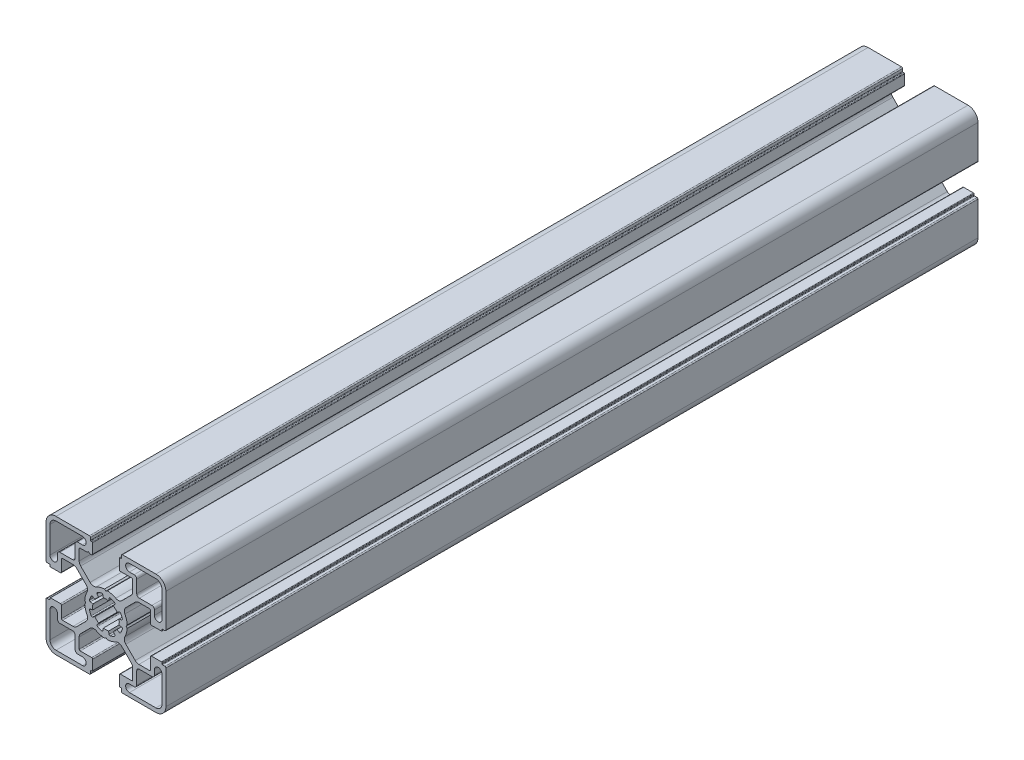
from build123d import *

# Parameters (mm, degrees)
BOSS_EXTRUDE1_DEPTH      = 152.4
FILLET4_R                = 1.95
FILLET5_R                = 0.39
DELETEFACE1_START        = -152.4
DELETEFACE1_DEPTH        = 304.8
CUT_EXTRUDE1_DEPTH       = 156.686415592
CIRPATTERN2_COUNT        = 3
CIRPATTERN2_ANGLE        = 180
FILLET2_R                = 0.39
FILLET3_R                = 0.195
CUT_EXTRUDE2_DEPTH       = 307.456424309
CUT_EXTRUDE2_DEPTH_BACK  = 307.456424309
SKETCH5_R                = 6.375
BOSS_EXTRUDE2_DEPTH      = 152.4
FILLET6_R                = 0.39
CIRPATTERN1_COUNT        = 8
FILLET6_OF_CIRPATTERN1_R = 0.39
CUT_EXTRUDE3_DEPTH       = 156.686415592
CUT_EXTRUDE3_DEPTH_BACK  = 156.686415592


# Read off the part's stored shape, not the designer's step: DeleteFace1
with BuildPart() as part:
    # Sketch3 → Boss-Extrude1 (new, symmetric)
    with BuildSketch(Plane.XY):
        with BuildLine():
            Line((0, -8), (0, -5))
            ThreePointArc((0, -5), (3.535533906, -3.535533906), (5, 0))
            Line((5, 0), (8, 0))
            ThreePointArc((8, 0), (7.578104083, -2.563657252), (6.356915373, -4.856915373))
            Line((6.356915373, -4.856915373), (11.55, -10.05))
            Line((11.55, -10.05), (16.7, -10.05))
            Line((16.7, -10.05), (16.7, -5))
            Line((16.7, -5), (21, -5))
            Line((21, -5), (21, 0))
            Line((21, 0), (22.5, 0))
            Line((22.5, 0), (22.5, -18.75))
            ThreePointArc((22.5, -18.75), (21.401650429, -21.401650429), (18.75, -22.5))
            Line((18.75, -22.5), (0, -22.5))
            Line((0, -22.5), (0, -21))
            Line((0, -21), (5, -21))
            Line((5, -21), (5, -16.7))
            Line((5, -16.7), (10.05, -16.7))
            Line((10.05, -16.7), (10.05, -11.55))
            Line((10.05, -11.55), (4.856915373, -6.356915373))
            ThreePointArc((4.856915373, -6.356915373), (2.563657252, -7.578104083), (0, -8))
        make_face()
        with BuildLine():
            Line((18.2, -8.79375), (18.2, -10.575))
            ThreePointArc((18.2, -10.575), (17.914429112, -11.264429112), (17.225, -11.55))
            Line((17.225, -11.55), (12.525, -11.55))
            ThreePointArc((12.525, -11.55), (11.835570888, -11.835570888), (11.55, -12.525))
            Line((11.55, -12.525), (11.55, -17.225))
            ThreePointArc((11.55, -17.225), (11.264429112, -17.914429112), (10.575, -18.2))
            Line((10.575, -18.2), (8.79375, -18.2))
            ThreePointArc((8.79375, -18.2), (7.39375, -19.6), (8.79375, -21))
            Line((8.79375, -21), (18.75, -21))
            ThreePointArc((18.75, -21), (20.340990258, -20.340990258), (21, -18.75))
            Line((21, -18.75), (21, -8.79375))
            ThreePointArc((21, -8.79375), (19.6, -7.39375), (18.2, -8.79375))
        make_face(mode=Mode.SUBTRACT)
    extrude(amount=BOSS_EXTRUDE1_DEPTH, both=True)

    # Fillet4
    fillet4_edges = [part.edges().sort_by_distance(p)[0] for p in [
        (10.05, -11.55, 0),
        (4.856915373, -6.356915373, 0),
        (6.356915373, -4.856915373, 0),
        (11.55, -10.05, 0),
    ]]
    fillet(fillet4_edges, radius=FILLET4_R)

    # Fillet5
    fillet5_edges = [part.edges().sort_by_distance(p)[0] for p in [
        (5, -21, 0),
        (5, -16.7, 0),
        (10.05, -16.7, 0),
        (16.7, -10.05, 0),
        (16.7, -5, 0),
        (21, -5, 0),
    ]]
    fillet(fillet5_edges, radius=FILLET5_R)

    # Mirror1: part across plane


with BuildPart() as part_1:
    add(part.part)
    add(part.part.mirror(Plane.ZX))

    # DeleteFace1 outline → DeleteFace1 (cut)
    with BuildSketch(Plane.XY.offset(DELETEFACE1_START)):
        with BuildLine():
            ThreePointArc((4.61, 21), (4.885771645, 20.885771645), (5, 20.61))
            Line((5, 20.61), (5, 21))
            Line((5, 21), (4.61, 21))
        make_face()
    extrude(amount=DELETEFACE1_DEPTH, mode=Mode.SUBTRACT)

    # Sketch4 → Cut-Extrude1 (cut, symmetric)
    with BuildSketch(Plane.XY):
        Polygon((5.8, 21), (5.8, 22.5), (0, 22.5), (-5.8, 22.5), (-5.8, 21), (-5, 21), (-5, 16.7), (5, 16.7), (5, 21), align=None)
    cut_extrude1 = extrude(amount=CUT_EXTRUDE1_DEPTH, both=True, mode=Mode.SUBTRACT)

    # CirPattern2: Cut-Extrude1 ×3 about axis
    cirpattern2_axis = Axis((0, 0, 107.4), (0, 0, -1))
    for i in range(1, CIRPATTERN2_COUNT):
        add(cut_extrude1.rotate(cirpattern2_axis, i * CIRPATTERN2_ANGLE / (CIRPATTERN2_COUNT - 1)), mode=Mode.SUBTRACT)

    # Fillet2
    fillet2_edges = [part_1.edges().sort_by_distance(p)[0] for p in [
        (5.8, 22.5, 0),
        (22.5, 5.8, 0),
        (22.5, -5.8, 0),
        (5.8, -22.5, 0),
    ]]
    fillet(fillet2_edges, radius=FILLET2_R)

    # Fillet3
    fillet3_edges = [part_1.edges().sort_by_distance(p)[0] for p in [
        (5, 21, 0),
        (5.8, 21, 0),
        (21, -5, 0),
        (21, -5.8, 0),
        (21, 5, 0),
        (21, 5.8, 0),
        (5, -21, 0),
        (5.8, -21, 0),
    ]]
    fillet(fillet3_edges, radius=FILLET3_R)

    # Mirror2: part across plane


with BuildPart() as part_2:
    add(part_1.part)
    add(part_1.part.mirror(Plane(origin=(0, 0, 0), x_dir=(0, 0, 1), z_dir=(1, 0, 0))))

    # Sketch5 → Cut-Extrude2 (cut, two sides: drawn at the far end of the back side and taken through both)
    with BuildSketch(Plane.XY.offset(152.4).offset(-CUT_EXTRUDE2_DEPTH_BACK)):
        Circle(SKETCH5_R)
        Polygon((-0.580185128, 8), (0.580185128, 8), (0, 7.59375), align=None)
        Polygon((-8, 0.580185128), (-8, -0.580185128), (-7.59375, 0), align=None)
        Polygon((8, 0.580185128), (8, -0.580185128), (7.59375, 0), align=None)
        Polygon((-0.580185128, -8), (0.580185128, -8), (0, -7.59375), align=None)
    extrude(amount=CUT_EXTRUDE2_DEPTH + CUT_EXTRUDE2_DEPTH_BACK, mode=Mode.SUBTRACT)

    # Sketch6 → Boss-Extrude2 (add, symmetric)
    with BuildSketch(Plane.XY):
        with BuildLine():
            Line((-0.97545161, -4.903926402), (-1.243700803, -6.252506163))
            ThreePointArc((-1.243700803, -6.252506163), (0, -6.375), (1.243700803, -6.252506163))
            Line((1.243700803, -6.252506163), (0.97545161, -4.903926402))
            ThreePointArc((0.97545161, -4.903926402), (0, -5), (-0.97545161, -4.903926402))
        make_face()
    boss_extrude2 = extrude(amount=BOSS_EXTRUDE2_DEPTH, both=True)

    # Fillet6
    fillet6_edges = [part_2.edges().sort_by_distance(p)[0] for p in [
        (-1.243700803, -6.252506163, 0),
        (1.243700803, -6.252506163, 0),
    ]]
    fillet(fillet6_edges, radius=FILLET6_R)

    # CirPattern1: Boss-Extrude2 ×8 about axis
    cirpattern1_axis = Axis((0, 0, 0), (0, 0, 1))
    for i in range(1, CIRPATTERN1_COUNT):
        add(boss_extrude2.rotate(cirpattern1_axis, i * 360 / CIRPATTERN1_COUNT))

    # Fillet6 of CirPattern1
    fillet6_of_cirpattern1_edges = [part_2.edges().sort_by_distance(p)[0] for p in [
        (3.541760235, -5.300618778, 0),
        (5.300618778, -3.541760235, 0),
        (6.252506163, -1.243700803, 0),
        (6.252506163, 1.243700803, 0),
        (5.300618778, 3.541760235, 0),
        (3.541760235, 5.300618778, 0),
        (1.243700803, 6.252506163, 0),
        (-1.243700803, 6.252506163, 0),
        (-3.541760235, 5.300618778, 0),
        (-5.300618778, 3.541760235, 0),
        (-6.252506163, 1.243700803, 0),
        (-6.252506163, -1.243700803, 0),
        (-5.300618778, -3.541760235, 0),
        (-3.541760235, -5.300618778, 0),
    ]]
    fillet(fillet6_of_cirpattern1_edges, radius=FILLET6_OF_CIRPATTERN1_R)

    # Sketch7 → Cut-Extrude3 (cut, two sides: drawn at the far end of the back side and taken through both)
    with BuildSketch(Plane.XY.offset(-CUT_EXTRUDE3_DEPTH_BACK)):
        Polygon((-7.046875, 16.7), (-6.596875, 17.15), (-6.146875, 16.7), align=None)
    extrude(amount=CUT_EXTRUDE3_DEPTH + CUT_EXTRUDE3_DEPTH_BACK, mode=Mode.SUBTRACT)


solid = part_2.part
